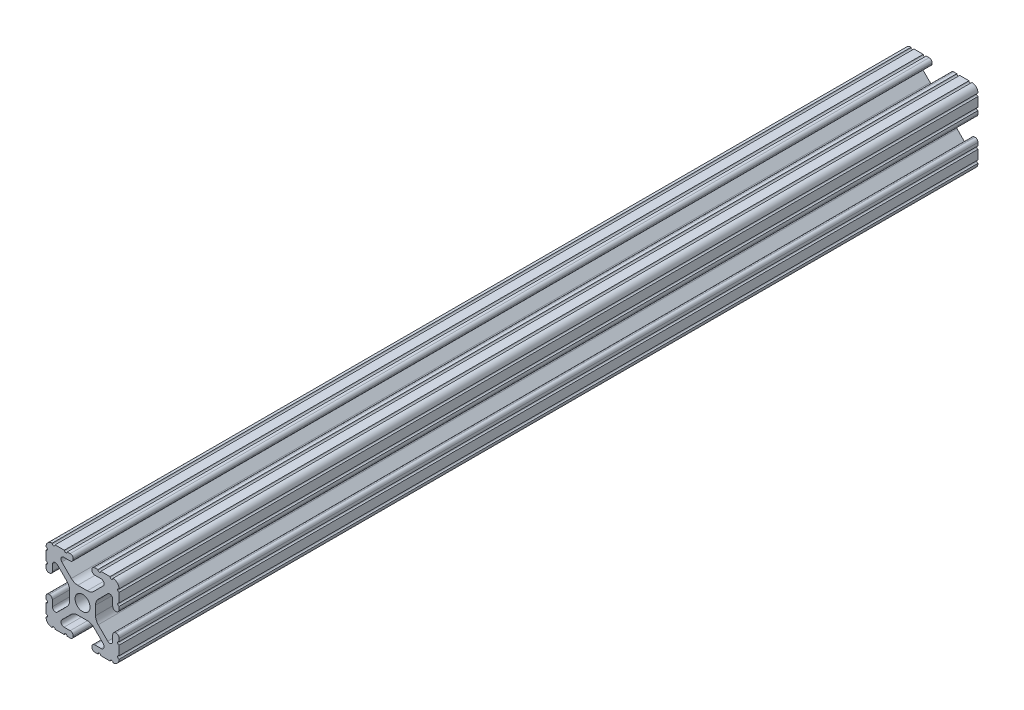
from build123d import *

# Parameters (mm, degrees)
SKETCH1_R           = 2.6035
BOSS_EXTRUDE1_DEPTH = 149.225


with BuildPart() as part:
    # Sketch1 → Boss-Extrude1 (new, symmetric)
    with BuildSketch(Plane.XY):
        with BuildLine():
            Line((-7.179650497, -8.645192506), (-3.952270251, -5.423690499))
            ThreePointArc((-3.952270251, -5.423690499), (-2.922936451, -4.736929036), (-1.709253557, -4.4958))
            Line((-1.709253557, -4.4958), (1.709253557, -4.4958))
            ThreePointArc((1.709253557, -4.4958), (2.922936451, -4.736929036), (3.952270251, -5.423690499))
            Line((3.952270251, -5.423690499), (7.179650497, -8.645192506))
            ThreePointArc((7.179650497, -8.645192506), (7.41473083, -9.822813117), (6.416408329, -10.4902))
            Line((6.416408329, -10.4902), (4.287512407, -10.4902))
            ThreePointArc((4.287512407, -10.4902), (3.54574862, -10.79744862), (3.2385, -11.539212407))
            Line((3.2385, -11.539212407), (3.2385, -11.650987593))
            ThreePointArc((3.2385, -11.650987593), (3.54574862, -12.39275138), (4.287512407, -12.7))
            Line((4.287512407, -12.7), (5.317126718, -12.7))
            ThreePointArc((5.317126718, -12.7), (5.825126718, -12.192), (6.333126718, -12.7))
            Line((6.333126718, -12.7), (9.550443118, -12.7))
            ThreePointArc((9.550443118, -12.7), (10.058366869, -12.192000006), (10.566443095, -12.699847501))
            ThreePointArc((10.566443095, -12.699847501), (12.082537762, -12.08250727), (12.699846982, -10.566399977))
            ThreePointArc((12.699846982, -10.566399977), (12.192000006, -10.058323491), (12.7, -9.5504))
            Line((12.7, -9.5504), (12.7, -6.3330836))
            ThreePointArc((12.7, -6.3330836), (12.192, -5.8250836), (12.7, -5.3170836))
            Line((12.7, -5.3170836), (12.7, -4.287469289))
            ThreePointArc((12.7, -4.287469289), (12.39275138, -3.545705502), (11.650987593, -3.238456882))
            Line((11.650987593, -3.238456882), (11.539212407, -3.238456882))
            ThreePointArc((11.539212407, -3.238456882), (10.79744862, -3.545705502), (10.4902, -4.287469289))
            Line((10.4902, -4.287469289), (10.4902, -6.402089023))
            ThreePointArc((10.4902, -6.402089023), (9.856505071, -7.351067942), (8.737131347, -7.129408934))
            Line((8.737131347, -7.129408934), (5.441005833, -3.840816462))
            ThreePointArc((5.441005833, -3.840816462), (4.750877967, -2.809883091), (4.5085, -1.593185507))
            Line((4.5085, -1.593185507), (4.5085, 1.593185507))
            ThreePointArc((4.5085, 1.593185507), (4.750877967, 2.809883091), (5.441005833, 3.840816462))
            Line((5.441005833, 3.840816462), (8.737131347, 7.129408934))
            ThreePointArc((8.737131347, 7.129408934), (9.856505071, 7.351067942), (10.4902, 6.402089023))
            Line((10.4902, 6.402089023), (10.4902, 4.287469289))
            ThreePointArc((10.4902, 4.287469289), (10.79744862, 3.545705502), (11.539212407, 3.238456882))
            Line((11.539212407, 3.238456882), (11.650987593, 3.238456882))
            ThreePointArc((11.650987593, 3.238456882), (12.39275138, 3.545705502), (12.7, 4.287469289))
            Line((12.7, 4.287469289), (12.7, 5.3170836))
            ThreePointArc((12.7, 5.3170836), (12.192, 5.8250836), (12.7, 6.3330836))
            Line((12.7, 6.3330836), (12.7, 9.5504))
            ThreePointArc((12.7, 9.5504), (12.192000006, 10.058323491), (12.699846982, 10.566399977))
            ThreePointArc((12.699846982, 10.566399977), (12.082537762, 12.08250727), (10.566443095, 12.699847501))
            ThreePointArc((10.566443095, 12.699847501), (10.058366869, 12.192000006), (9.550443118, 12.7))
            Line((9.550443118, 12.7), (6.333126718, 12.7))
            ThreePointArc((6.333126718, 12.7), (5.825126718, 12.192), (5.317126718, 12.7))
            Line((5.317126718, 12.7), (4.287512407, 12.7))
            ThreePointArc((4.287512407, 12.7), (3.54574862, 12.39275138), (3.2385, 11.650987593))
            Line((3.2385, 11.650987593), (3.2385, 11.539212407))
            ThreePointArc((3.2385, 11.539212407), (3.54574862, 10.79744862), (4.287512407, 10.4902))
            Line((4.287512407, 10.4902), (6.476788598, 10.4902))
            ThreePointArc((6.476788598, 10.4902), (7.432222385, 9.85140422), (7.207036008, 8.724370562))
            Line((7.207036008, 8.724370562), (3.898272566, 5.423169045))
            ThreePointArc((3.898272566, 5.423169045), (2.869120213, 4.736787962), (1.655778399, 4.4958))
            Line((1.655778399, 4.4958), (-1.655778399, 4.4958))
            ThreePointArc((-1.655778399, 4.4958), (-2.869120213, 4.736787962), (-3.898272566, 5.423169045))
            Line((-3.898272566, 5.423169045), (-7.207036008, 8.724370562))
            ThreePointArc((-7.207036008, 8.724370562), (-7.432222385, 9.85140422), (-6.476788598, 10.4902))
            Line((-6.476788598, 10.4902), (-4.287512407, 10.4902))
            ThreePointArc((-4.287512407, 10.4902), (-3.54574862, 10.79744862), (-3.2385, 11.539212407))
            Line((-3.2385, 11.539212407), (-3.2385, 11.650987593))
            ThreePointArc((-3.2385, 11.650987593), (-3.54574862, 12.39275138), (-4.287512407, 12.7))
            Line((-4.287512407, 12.7), (-5.317126718, 12.7))
            ThreePointArc((-5.317126718, 12.7), (-5.825126718, 12.192), (-6.333126718, 12.7))
            Line((-6.333126718, 12.7), (-9.550443118, 12.7))
            ThreePointArc((-9.550443118, 12.7), (-10.058366869, 12.192000006), (-10.566443095, 12.699847501))
            ThreePointArc((-10.566443095, 12.699847501), (-12.082537762, 12.08250727), (-12.699846982, 10.566399977))
            ThreePointArc((-12.699846982, 10.566399977), (-12.192000006, 10.058323491), (-12.7, 9.5504))
            Line((-12.7, 9.5504), (-12.7, 6.3330836))
            ThreePointArc((-12.7, 6.3330836), (-12.192, 5.8250836), (-12.7, 5.3170836))
            Line((-12.7, 5.3170836), (-12.7, 4.287469289))
            ThreePointArc((-12.7, 4.287469289), (-12.39275138, 3.545705502), (-11.650987593, 3.238456882))
            Line((-11.650987593, 3.238456882), (-11.539212407, 3.238456882))
            ThreePointArc((-11.539212407, 3.238456882), (-10.79744862, 3.545705502), (-10.4902, 4.287469289))
            Line((-10.4902, 4.287469289), (-10.4902, 6.402089023))
            ThreePointArc((-10.4902, 6.402089023), (-9.856505071, 7.351067942), (-8.737131347, 7.129408934))
            Line((-8.737131347, 7.129408934), (-5.441005833, 3.840816462))
            ThreePointArc((-5.441005833, 3.840816462), (-4.750877967, 2.809883091), (-4.5085, 1.593185507))
            Line((-4.5085, 1.593185507), (-4.5085, -1.593185507))
            ThreePointArc((-4.5085, -1.593185507), (-4.750877967, -2.809883091), (-5.441005833, -3.840816462))
            Line((-5.441005833, -3.840816462), (-8.737131347, -7.129408934))
            ThreePointArc((-8.737131347, -7.129408934), (-9.856505071, -7.351067942), (-10.4902, -6.402089023))
            Line((-10.4902, -6.402089023), (-10.4902, -4.287469289))
            ThreePointArc((-10.4902, -4.287469289), (-10.79744862, -3.545705502), (-11.539212407, -3.238456882))
            Line((-11.539212407, -3.238456882), (-11.650987593, -3.238456882))
            ThreePointArc((-11.650987593, -3.238456882), (-12.39275138, -3.545705502), (-12.7, -4.287469289))
            Line((-12.7, -4.287469289), (-12.7, -5.3170836))
            ThreePointArc((-12.7, -5.3170836), (-12.192, -5.8250836), (-12.7, -6.3330836))
            Line((-12.7, -6.3330836), (-12.7, -9.5504))
            ThreePointArc((-12.7, -9.5504), (-12.192000006, -10.058323491), (-12.699846982, -10.566399977))
            ThreePointArc((-12.699846982, -10.566399977), (-12.082537762, -12.08250727), (-10.566443095, -12.699847501))
            ThreePointArc((-10.566443095, -12.699847501), (-10.058366869, -12.192000006), (-9.550443118, -12.7))
            Line((-9.550443118, -12.7), (-6.333126718, -12.7))
            ThreePointArc((-6.333126718, -12.7), (-5.825126718, -12.192), (-5.317126718, -12.7))
            Line((-5.317126718, -12.7), (-4.287512407, -12.7))
            ThreePointArc((-4.287512407, -12.7), (-3.54574862, -12.39275138), (-3.2385, -11.650987593))
            Line((-3.2385, -11.650987593), (-3.2385, -11.539212407))
            ThreePointArc((-3.2385, -11.539212407), (-3.54574862, -10.79744862), (-4.287512407, -10.4902))
            Line((-4.287512407, -10.4902), (-6.416408329, -10.4902))
            ThreePointArc((-6.416408329, -10.4902), (-7.41473083, -9.822813117), (-7.179650497, -8.645192506))
        make_face()
        Circle(SKETCH1_R, mode=Mode.SUBTRACT)
    extrude(amount=BOSS_EXTRUDE1_DEPTH, both=True)


solid = part.part
